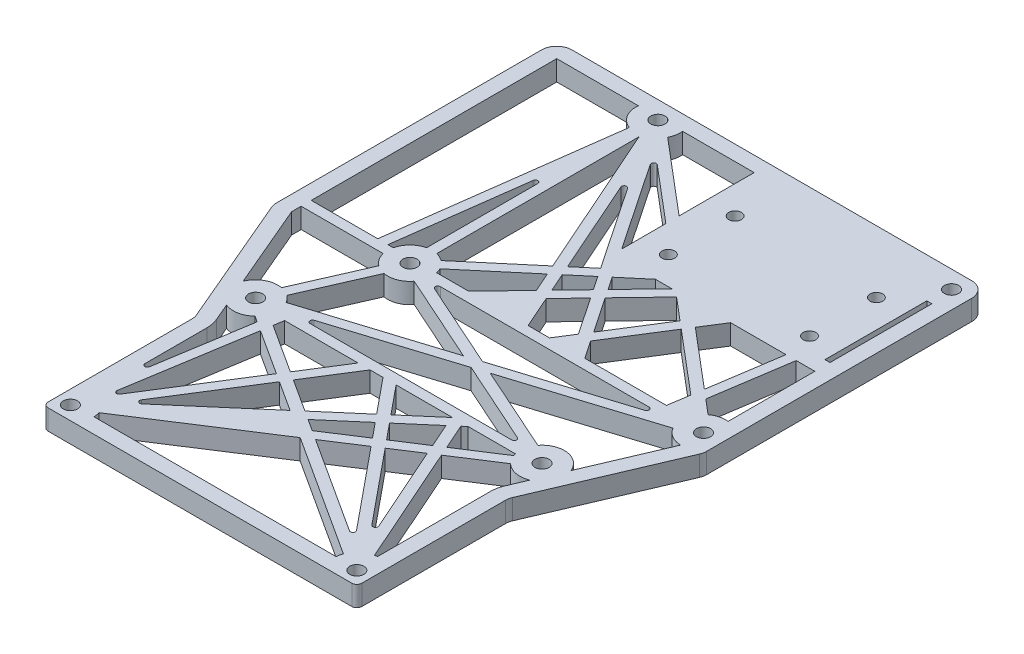
from build123d import *

# Parameters (mm, degrees)
BOSS_EXTRUDE1_DEPTH = 4
SKETCH2_R           = 1.4
CUT_EXTRUDE1_DEPTH  = 96.117033175
SKETCH4_W           = 33
SKETCH4_H           = 28
SKETCH4_R           = 0.75
CUT_EXTRUDE2_DEPTH  = 2
SHELL5_OUTLINE_R    = 4.4
SHELL5_DEPTH        = 1
RIB9_DEPTH          = 1
BOSS_EXTRUDE8_START = 1
SKETCH24_W          = 1
SKETCH24_H          = 3
BOSS_EXTRUDE8_DEPTH = 1
FILLET6_R           = 0.5
FILLET8_R           = 0.5
SKETCH28_OUTSIDE_W  = 115.292
SKETCH28_OUTSIDE_H  = 143.292
CUT_EXTRUDE4_DEPTH  = 4
SKETCH30_R          = 1.25
CUT_EXTRUDE5_DEPTH  = 96.117033175


# Read off the part's stored shape, not the designer's step: Shell5, Rib9
with BuildPart() as part:
    # Sketch1 → Boss-Extrude1 (new body)
    with BuildSketch(Plane(origin=(0, 0, 0), x_dir=(1, 0, 0), z_dir=(0, 1, 0))):
        with BuildLine():
            Line((-42.260071937, -28.563309365), (-31.239928063, -54.436690635))
            ThreePointArc((-31.239928063, -54.436690635), (-31.060593954, -55.012366758), (-31, -55.61227683))
            Line((-31, -55.61227683), (-31, -84))
            ThreePointArc((-31, -84), (-30.707106781, -84.707106781), (-30, -85))
            Line((-30, -85), (30, -85))
            ThreePointArc((30, -85), (30.707106781, -84.707106781), (31, -84))
            Line((31, -84), (31, -55.61227683))
            ThreePointArc((31, -55.61227683), (31.060593954, -55.012366758), (31.239928063, -54.436690635))
            Line((31.239928063, -54.436690635), (42.260071937, -28.563309365))
            ThreePointArc((42.260071937, -28.563309365), (42.439406046, -27.987633242), (42.5, -27.38772317))
            Line((42.5, -27.38772317), (42.5, 25))
            ThreePointArc((42.5, 25), (41.621320344, 27.121320344), (39.5, 28))
            Line((39.5, 28), (-39.5, 28))
            ThreePointArc((-39.5, 28), (-41.621320344, 27.121320344), (-42.5, 25))
            Line((-42.5, 25), (-42.5, -27.38772317))
            ThreePointArc((-42.5, -27.38772317), (-42.439406046, -27.987633242), (-42.260071937, -28.563309365))
        make_face()
    extrude(amount=BOSS_EXTRUDE1_DEPTH)

    # Sketch2 → Cut-Extrude1 (cut, through all)
    with BuildSketch(Plane(origin=(0, 4, 0), x_dir=(1, 0, 0), z_dir=(0, 1, 0))):
        with Locations(Location((39, 24.5, 0), (0, 0, 270))):
            Circle(SKETCH2_R)
        with Locations(Location((-19, 24.5, 0), (0, 0, 270))):
            Circle(SKETCH2_R)
        with Locations(Location((-19, -24.5, 0), (0, 0, 270))):
            Circle(SKETCH2_R)
        with Locations(Location((39, -24.5, 0), (0, 0, 270))):
            Circle(SKETCH2_R)
        with Locations(Location((-28.3, -82.3, 0), (0, 0, 270))):
            Circle(SKETCH2_R)
        with Locations(Location((-28.3, -45.7, 0), (0, 0, 270))):
            Circle(SKETCH2_R)
        with Locations(Location((28.3, -45.7, 0), (0, 0, 270))):
            Circle(SKETCH2_R)
        with Locations(Location((28.3, -82.3, 0), (0, 0, 270))):
            Circle(SKETCH2_R)
    extrude(amount=-CUT_EXTRUDE1_DEPTH, mode=Mode.SUBTRACT)

    # Sketch4 → Cut-Extrude2 (cut)
    with BuildSketch(Plane.XZ):
        with Locations((19, -14)):
            Rectangle(SKETCH4_W, SKETCH4_H)
        with Locations(Location((32.95, -2.5, 0), (0, 0, 270))):
            Circle(SKETCH4_R, mode=Mode.SUBTRACT)
        with Locations(Location((5.05, -2.5, 0), (0, 0, 270))):
            Circle(SKETCH4_R, mode=Mode.SUBTRACT)
        with Locations(Location((5.05, -15.7, 0), (0, 0, 270))):
            Circle(SKETCH4_R, mode=Mode.SUBTRACT)
        with Locations(Location((32.95, -15.7, 0), (0, 0, 270))):
            Circle(SKETCH4_R, mode=Mode.SUBTRACT)
    extrude(amount=-CUT_EXTRUDE2_DEPTH, mode=Mode.SUBTRACT)

    # Shell5 outline → Shell5 (cut)
    with BuildSketch(Plane(origin=(0, 0, 0), x_dir=(1, 0, 0), z_dir=(0, 1, 0))):
        with BuildLine():
            Line((-39.5, -27.38772317), (-32.390632359, -44.079281979))
            ThreePointArc((-32.390632359, -44.079281979), (-24.251894492, -43.975806914), (-29.965740458, -49.772506443))
            Line((-29.965740458, -49.772506443), (-28.479856126, -53.261104439))
            ThreePointArc((-28.479856126, -53.261104439), (-28.121187907, -54.412456686), (-28, -55.61227683))
            Line((-28, -55.61227683), (-28, -77.910239186))
            ThreePointArc((-28, -77.910239186), (-25.188730163, -79.188730163), (-23.910239186, -82))
            Line((-23.910239186, -82), (23.910239186, -82))
            ThreePointArc((23.910239186, -82), (25.188730163, -79.188730163), (28, -77.910239186))
            Line((28, -77.910239186), (28, -55.61227683))
            ThreePointArc((28, -55.61227683), (28.121187907, -54.412456686), (28.479856126, -53.261104439))
            Line((28.479856126, -53.261104439), (29.965740458, -49.772506443))
            ThreePointArc((29.965740458, -49.772506443), (24.251894492, -43.975806914), (32.390632359, -44.079281979))
            Line((32.390632359, -44.079281979), (38.856873846, -28.897671532))
            ThreePointArc((38.856873846, -28.897671532), (34.611785565, -24.178170747), (39.5, -20.128501401))
            Line((39.5, -20.128501401), (39.5, 20.128501401))
            ThreePointArc((39.5, 20.128501401), (39, 20.1), (38.5, 20.128501401))
            Line((38.5, 20.128501401), (38.5, -3))
            Line((38.5, -3), (-0.5, -3))
            Line((-0.5, -3), (-0.5, 25))
            Line((-0.5, 25), (-14.628501401, 25))
            ThreePointArc((-14.628501401, 25), (-19, 20.1), (-23.371498599, 25))
            Line((-23.371498599, 25), (-39.5, 25))
            Line((-39.5, 25), (-39.5, -27.38772317))
        make_face()
        with Locations((-19, -24.5)):
            Circle(SHELL5_OUTLINE_R, mode=Mode.SUBTRACT)
    extrude(amount=SHELL5_DEPTH, mode=Mode.SUBTRACT)

    # Rib9 outline → Rib9 (add)
    # profile 1 of 2: a face of its own
    with BuildSketch(Plane(origin=(0, 0, 0), x_dir=(1, 0, 0), z_dir=(0, 1, 0))):
        with BuildLine():
            Line((24.158874624, -47.186970285), (16.139376012, -52.372723805))
            Line((16.139376012, -52.372723805), (13.918839758, -47.358912558))
            Line((13.918839758, -47.358912558), (14.686051093, -46.7))
            Line((14.686051093, -46.7), (24.015142942, -46.7))
            ThreePointArc((24.015142942, -46.7), (23.997287992, -44.779853608), (24.798922096, -43.034957127))
            Line((24.798922096, -43.034957127), (7.748485262, -35.392900872))
            Line((7.748485262, -35.392900872), (35.213570864, -26.741194858))
            ThreePointArc((35.213570864, -26.741194858), (34.651120693, -25.168766601), (34.715142943, -23.5))
            Line((34.715142943, -23.5), (32.695310169, -23.5))
            Line((32.695310169, -23.5), (33.102743661, -20.826931664))
            Line((33.102743661, -20.826931664), (35.081507638, -22.498646057))
            ThreePointArc((35.081507638, -22.498646057), (35.638903248, -21.660452744), (36.372210936, -20.970874806))
            Line((36.372210936, -20.970874806), (33.456287163, -18.507421963))
            Line((33.456287163, -18.507421963), (35.819954043, -3))
            Line((35.819954043, -3), (33.796855074, -3))
            Line((33.796855074, -3), (31.663983204, -16.993234136))
            Line((31.663983204, -16.993234136), (20.15959754, -7.274011765))
            Line((20.15959754, -7.274011765), (22.852865254, -3))
            Line((22.852865254, -3), (20.488895046, -3))
            Line((20.488895046, -3), (18.61690656, -5.970703868))
            Line((18.61690656, -5.970703868), (15.100563206, -3))
            Line((15.100563206, -3), (11.250729279, -3))
            Line((11.250729279, -3), (5.075272379, -9.441561284))
            Line((5.075272379, -9.441561284), (3.36983318, -6.910444333))
            Line((3.36983318, -6.910444333), (7.99852239, -3))
            Line((7.99852239, -3), (4.899436794, -3))
            Line((4.899436794, -3), (2.24564889, -5.24199323))
            Line((2.24564889, -5.24199323), (0.90818106, -3.256998692))
            Line((0.90818106, -3.256998692), (1.289604065, -3))
            Line((1.289604065, -3), (-0.5, -3))
            Line((-0.5, -3), (-0.5, -1.167055554))
            Line((-0.5, -1.167055554), (-14.153101582, 19.096110008))
            Line((-14.153101582, 19.096110008), (-0.5, 7.561593154))
            Line((-0.5, 7.561593154), (-0.5, 10.179786157))
            Line((-0.5, 10.179786157), (-15.081507637, 22.498646057))
            ThreePointArc((-15.081507637, 22.498646057), (-17.413813627, 20.395854195), (-20.554073865, 20.38358719))
            Line((-20.554073865, 20.38358719), (-26.367711484, -23.5))
            Line((-26.367711484, -23.5), (-39.5, -23.5))
            Line((-39.5, -23.5), (-39.5, -25.5))
            Line((-39.5, -25.5), (-23.284857057, -25.5))
            ThreePointArc((-23.284857057, -25.5), (-23.4, -24.5), (-23.284857057, -23.5))
            Line((-23.284857057, -23.5), (-24.350237234, -23.5))
            Line((-24.350237234, -23.5), (-20, 9.337274602))
            Line((-20, 9.337274602), (-20, -20.215142943))
            ThreePointArc((-20, -20.215142943), (-19, -20.1), (-18, -20.215142943))
            Line((-18, -20.215142943), (-18, 19.772610526))
            Line((-18, 19.772610526), (-4.425393925, -10.877874228))
            Line((-4.425393925, -10.877874228), (-16.372210936, -20.970874806))
            ThreePointArc((-16.372210936, -20.970874806), (-15.638903248, -21.660452743), (-15.081507637, -22.498646057))
            Line((-15.081507637, -22.498646057), (-3.581565647, -12.783177824))
            Line((-3.581565647, -12.783177824), (-1.858385445, -16.673994854))
            Line((-1.858385445, -16.673994854), (-8.402404624, -23.5))
            Line((-8.402404624, -23.5), (-14.715142943, -23.5))
            ThreePointArc((-14.715142943, -23.5), (-14.697287993, -25.420146392), (-15.498922096, -27.165042873))
            Line((-15.498922096, -27.165042873), (2.12935069, -35.066086912))
            Line((2.12935069, -35.066086912), (-24.513570863, -43.458805142))
            ThreePointArc((-24.513570863, -43.458805142), (-23.951120692, -45.031233399), (-24.015142942, -46.7))
            Line((-24.015142942, -46.7), (-23.584833957, -46.7))
            Line((-23.584833957, -46.7), (-23.709900649, -47.477296214))
            Line((-23.709900649, -47.477296214), (-24.158874624, -47.186970285))
            ThreePointArc((-24.158874624, -47.186970285), (-24.605190908, -48.08922284), (-25.244885006, -48.866428964))
            Line((-25.244885006, -48.866428964), (-24.057004266, -49.634563859))
            Line((-24.057004266, -49.634563859), (-28, -74.140494333))
            Line((-28, -74.140494333), (-28, -77.910239186))
            ThreePointArc((-28, -77.910239186), (-25.647181337, -78.789650568), (-24.158874625, -80.813029715))
            Line((-24.158874625, -80.813029715), (0, -65.190859904))
            Line((0, -65.190859904), (24.158874625, -80.813029715))
            ThreePointArc((24.158874625, -80.813029715), (25.442448124, -78.954197066), (27.479202001, -77.977235763))
            Line((27.479202001, -77.977235763), (16.959366166, -54.224202631))
            Line((16.959366166, -54.224202631), (25.244885006, -48.866428964))
            ThreePointArc((25.244885006, -48.866428964), (24.605190908, -48.08922284), (24.158874624, -47.186970285))
        make_face()
        Polygon((-1.841603021, -64), (-16.475927059, -73.463184802), (-3.90431016, -62.666164642), align=None, mode=Mode.SUBTRACT)
        Polygon((-22.222184205, -50.821037609), (-13.28660915, -56.599165648), (-26.534554532, -77.622651039), align=None, mode=Mode.SUBTRACT)
        Polygon((-11.607035166, -57.685250592), (-5.655485793, -61.533778985), (-23.913270157, -77.214312956), align=None, mode=Mode.SUBTRACT)
        Polygon((-21.875080587, -48.663769963), (-21.55911068, -46.7), (-7.048651771, -46.7), (-12.220279169, -54.906980775), align=None, mode=Mode.SUBTRACT)
        Polygon((-10.540705185, -55.993065719), (-4.684681562, -46.7), (-2.125032521, -46.7), (3.54659391, -53.630655554), (-4.073456613, -60.175067445), align=None, mode=Mode.SUBTRACT)
        Polygon((23.485727644, -77.99602405), (1.841603021, -64), (8.505746728, -59.690677391), align=None, mode=Mode.SUBTRACT)
        Polygon((7.231166278, -58.133156249), (0, -62.809140096), (-2.322280979, -61.307453102), (4.813573543, -55.178888594), align=None, mode=Mode.SUBTRACT)
        Polygon((24.391991799, -75.945459753), (10.195758598, -58.59784286), (15.258969679, -55.323752302), align=None, mode=Mode.SUBTRACT)
        Polygon((11.616371053, -46.7), (5.064262408, -52.327219608), (0.459288576, -46.7), align=None, mode=Mode.SUBTRACT)
        Polygon((14.438979526, -53.472273477), (8.921178148, -57.040321718), (6.331242041, -53.875452648), (12.334210769, -48.71985692), align=None, mode=Mode.SUBTRACT)
        Polygon((-21.79716433, -44.7), (4.876801624, -36.297502553), (23.623883193, -44.7), align=None, mode=Mode.SUBTRACT)
        Polygon((32.49716433, -25.5), (5.001034327, -34.161485231), (-14.323883193, -25.5), align=None, mode=Mode.SUBTRACT)
        Polygon((-0.982895403, -18.650788438), (1.164742302, -23.5), (-5.63178341, -23.5), align=None, mode=Mode.SUBTRACT)
        Polygon((-13.495797967, 14.541368816), (0.708829585, -6.540340573), (-2.833608047, -9.533089607), align=None, mode=Mode.SUBTRACT)
        Polygon((9.777050976, -19.998884794), (7.570823885, -23.5), (3.35211163, -23.5), (0.513285951, -17.090135674), (4.802563572, -12.616030339), align=None, mode=Mode.SUBTRACT)
        Polygon((10.99859397, -21.81183021), (12.136064497, -23.5), (9.934794093, -23.5), align=None, mode=Mode.SUBTRACT)
        Polygon((1.833013875, -8.208791676), (3.659017469, -10.918843522), (-0.362204092, -15.11334209), (-1.989779769, -11.438393203), align=None, mode=Mode.SUBTRACT)
        Polygon((17.540237059, -7.679296775), (10.942511379, -18.149387453), (6.218818482, -11.138748101), (13.117474303, -3.942824792), align=None, mode=Mode.SUBTRACT)
        Polygon((31.310439703, -19.312743836), (30.672211199, -23.5), (14.547696186, -23.5), (12.164054373, -19.962332869), (19.08292804, -8.982604673), align=None, mode=Mode.SUBTRACT)
    # profile 2 of 2: a face of its own
    with BuildSketch(Plane(origin=(0, 0, 0), x_dir=(1, 0, 0), z_dir=(0, 1, 0))):
        with BuildLine():
            ThreePointArc((-27.494425912, -41.374372833), (-26.532409776, -41.670654544), (-25.66290525, -42.177822934))
            Line((-25.66290525, -42.177822934), (-19.805574088, -28.825627167))
            ThreePointArc((-19.805574088, -28.825627167), (-20.767590224, -28.529345456), (-21.63709475, -28.022177065))
            Line((-21.63709475, -28.022177065), (-27.494425912, -41.374372833))
        make_face()
    extrude(amount=RIB9_DEPTH)

    # Sketch24 → Boss-Extrude8 (add)
    with BuildSketch(Plane.XZ.offset(-1).offset(BOSS_EXTRUDE8_START)):
        Polygon((-16.475927059, 73.463184802), (-3.90431016, 62.666164642), (-1.841603021, 64), align=None)
        Polygon((18.61690656, 5.970703868), (15.100563206, 3), (20.488895046, 3), align=None)
        Polygon((0.90818106, 3.256998692), (1.289604065, 3), (4.899436794, 3), (2.24564889, 5.24199323), align=None)
        with BuildLine():
            Line((34.715142943, 23.5), (32.695310169, 23.5))
            Line((32.695310169, 23.5), (33.102743661, 20.826931664))
            Line((33.102743661, 20.826931664), (35.081507637, 22.498646057))
            ThreePointArc((35.081507637, 22.498646057), (34.867880344, 22.988184156), (34.715142943, 23.5))
        make_face()
        Polygon((10.99859397, 21.81183021), (12.136064497, 23.5), (9.934794093, 23.5), align=None)
        Polygon((-5.63178341, 23.5), (-0.982895403, 18.650788438), (1.164742302, 23.5), align=None)
        with BuildLine():
            Line((-24.015142943, 46.7), (-23.584833957, 46.7))
            Line((-23.584833957, 46.7), (-23.709900649, 47.477296214))
            Line((-23.709900649, 47.477296214), (-24.158874625, 47.186970285))
            ThreePointArc((-24.158874625, 47.186970285), (-24.079978673, 46.945560115), (-24.015142943, 46.7))
        make_face()
        with Locations((39, 1.5)):
            Rectangle(SKETCH24_W, SKETCH24_H)
    extrude(amount=-BOSS_EXTRUDE8_DEPTH)

    # Fillet6
    fillet6_edges = [part.edges().sort_by_distance(p)[0] for p in [
        (-28, 0.5, 74.140494333),
        (23.485727644, 0.5, 77.99602405),
        (-20, 0.5, -9.337274602),
        (-14.153101582, 0.5, -19.096110008),
        (-23.913270157, 0.5, 77.214312956),
        (-26.534554532, 0.5, 77.622651039),
        (-13.495797967, 0.5, -14.541368816),
        (24.391991799, 0.5, 75.945459753),
    ]]
    fillet(fillet6_edges, radius=FILLET6_R)

    # Fillet8
    fillet8_edges = [part.edges().sort_by_distance(p)[0] for p in [
        (32.49716433, 0.5, 25.5),
        (-14.323883193, 0.5, 25.5),
        (23.623883193, 0.5, 44.7),
        (-21.79716433, 0.5, 44.7),
    ]]
    fillet(fillet8_edges, radius=FILLET8_R)

    # Sketch28 outside → Cut-Extrude4 (cut)
    # profile 1 of 34: a face of its own
    with BuildSketch(Plane(origin=(0, 4, 0), x_dir=(1, 0, 0), z_dir=(0, 1, 0))):
        with Locations((0, -28.5)):
            Rectangle(SKETCH28_OUTSIDE_W, SKETCH28_OUTSIDE_H)
        with BuildLine():
            Line((31, -84), (31, -55.61227683))
            ThreePointArc((31, -55.61227683), (31.060593954, -55.012366758), (31.239928063, -54.436690635))
            Line((31.239928063, -54.436690635), (42.260074154, -28.563304159))
            ThreePointArc((42.260074154, -28.563304159), (42.439406612, -27.98763047), (42.5, -27.38772317))
            Line((42.5, -27.38772317), (42.5, 25))
            ThreePointArc((42.5, 25), (41.621320344, 27.121320344), (39.5, 28))
            Line((39.5, 28), (-39.5, 28))
            ThreePointArc((-39.5, 28), (-41.621320344, 27.121320344), (-42.5, 25))
            Line((-42.5, 25), (-42.5, -27.38772317))
            ThreePointArc((-42.5, -27.38772317), (-42.439406046, -27.987633242), (-42.260071937, -28.563309365))
            Line((-42.260071937, -28.563309365), (-31.239928063, -54.436690635))
            ThreePointArc((-31.239928063, -54.436690635), (-31.060593954, -55.012366758), (-31, -55.61227683))
            Line((-31, -55.61227683), (-31, -84))
            ThreePointArc((-31, -84), (-30.707106781, -84.707106781), (-30, -85))
            Line((-30, -85), (30, -85))
            ThreePointArc((30, -85), (30.707106781, -84.707106781), (31, -84))
        make_face(mode=Mode.SUBTRACT)
    # profile 2 of 34: a face of its own
    with BuildSketch(Plane(origin=(0, 4, 0), x_dir=(1, 0, 0), z_dir=(0, 1, 0))):
        with BuildLine():
            Line((0, -65.190859904), (24.158874625, -80.813029715))
            ThreePointArc((24.158874625, -80.813029715), (23.99346666, -81.397907657), (23.910239186, -82))
            Line((23.910239186, -82), (-23.910239186, -82))
            ThreePointArc((-23.910239186, -82), (-23.99346666, -81.397907657), (-24.158874625, -80.813029715))
            Line((-24.158874625, -80.813029715), (0, -65.190859904))
        make_face()
    # profile 3 of 34: a face of its own
    with BuildSketch(Plane(origin=(0, 4, 0), x_dir=(1, 0, 0), z_dir=(0, 1, 0))):
        with BuildLine():
            Line((27.479202001, -77.977235763), (16.959366166, -54.224202631))
            Line((16.959366166, -54.224202631), (25.244885007, -48.866428963))
            ThreePointArc((25.244885007, -48.866428963), (27.470642116, -50.021130118), (29.965740458, -49.772506443))
            Line((29.965740458, -49.772506443), (28.479856126, -53.261104439))
            ThreePointArc((28.479856126, -53.261104439), (28.121187907, -54.412456686), (28, -55.61227683))
            Line((28, -55.61227683), (28, -77.910239186))
            ThreePointArc((28, -77.910239186), (27.7386007, -77.935961638), (27.479202001, -77.977235763))
        make_face()
    # profile 4 of 34: a face of its own
    with BuildSketch(Plane(origin=(0, 4, 0), x_dir=(1, 0, 0), z_dir=(0, 1, 0))):
        with BuildLine():
            Line((15.258969679, -55.323752302), (22.895157865, -72.565716325))
            ThreePointArc((22.895157865, -72.565716325), (22.699915932, -73.194092905), (22.051038879, -73.084844978))
            Line((22.051038879, -73.084844978), (10.195758598, -58.59784286))
            Line((10.195758598, -58.59784286), (15.258969679, -55.323752302))
        make_face()
    # profile 5 of 34: a face of its own
    with BuildSketch(Plane(origin=(0, 4, 0), x_dir=(1, 0, 0), z_dir=(0, 1, 0))):
        with BuildLine():
            Line((8.505746728, -59.690677391), (21.465540287, -75.527380725))
            ThreePointArc((21.465540287, -75.527380725), (21.451347945, -76.177281641), (20.807088871, -76.263900744))
            Line((20.807088871, -76.263900744), (1.841603021, -64))
            Line((1.841603021, -64), (8.505746728, -59.690677391))
        make_face()
    # profile 6 of 34: a face of its own
    with BuildSketch(Plane(origin=(0, 4, 0), x_dir=(1, 0, 0), z_dir=(0, 1, 0))):
        Polygon((-2.322280979, -61.307453102), (4.813573543, -55.178888594), (7.231166278, -58.133156249), (0, -62.809140096), align=None)
    # profile 7 of 34: a face of its own
    with BuildSketch(Plane(origin=(0, 4, 0), x_dir=(1, 0, 0), z_dir=(0, 1, 0))):
        with BuildLine():
            Line((16.139376012, -52.372723805), (13.918839758, -47.358912558))
            Line((13.918839758, -47.358912558), (14.686051093, -46.7))
            Line((14.686051093, -46.7), (24.015142943, -46.7))
            ThreePointArc((24.015142943, -46.7), (24.079978673, -46.945560115), (24.158874625, -47.186970285))
            Line((24.158874625, -47.186970285), (16.139376012, -52.372723805))
        make_face()
    # profile 8 of 34: a face of its own
    with BuildSketch(Plane(origin=(0, 4, 0), x_dir=(1, 0, 0), z_dir=(0, 1, 0))):
        Polygon((6.331242041, -53.875452648), (12.334210769, -48.71985692), (14.438979526, -53.472273477), (8.921178148, -57.040321718), align=None)
    # profile 9 of 34: a face of its own
    with BuildSketch(Plane(origin=(0, 4, 0), x_dir=(1, 0, 0), z_dir=(0, 1, 0))):
        Polygon((11.616371053, -46.7), (5.064262408, -52.327219608), (0.459288576, -46.7), align=None)
    # profile 10 of 34: a face of its own
    with BuildSketch(Plane(origin=(0, 4, 0), x_dir=(1, 0, 0), z_dir=(0, 1, 0))):
        with BuildLine():
            Line((-5.655485793, -61.533778985), (-21.394138385, -75.050779279))
            ThreePointArc((-21.394138385, -75.050779279), (-22.046482524, -75.050081736), (-22.142922411, -74.40490524))
            Line((-22.142922411, -74.40490524), (-11.607035166, -57.685250592))
            Line((-11.607035166, -57.685250592), (-5.655485793, -61.533778985))
        make_face()
    # profile 11 of 34: a face of its own
    with BuildSketch(Plane(origin=(0, 4, 0), x_dir=(1, 0, 0), z_dir=(0, 1, 0))):
        Polygon((-4.073456613, -60.175067445), (-10.540705185, -55.993065719), (-4.684681562, -46.7), (-2.125032521, -46.7), (3.54659391, -53.630655554), align=None)
    # profile 12 of 34: a face of its own
    with BuildSketch(Plane(origin=(0, 4, 0), x_dir=(1, 0, 0), z_dir=(0, 1, 0))):
        Polygon((-21.55911068, -46.7), (-7.048651771, -46.7), (-12.220279169, -54.906980775), (-21.875080587, -48.663769963), align=None)
    # profile 13 of 34: a face of its own
    with BuildSketch(Plane(origin=(0, 4, 0), x_dir=(1, 0, 0), z_dir=(0, 1, 0))):
        with BuildLine():
            Line((-13.28660915, -56.599165648), (-25.228814623, -75.550540752))
            ThreePointArc((-25.228814623, -75.550540752), (-25.828396153, -75.751763934), (-26.14548264, -75.204548309))
            Line((-26.14548264, -75.204548309), (-22.222184205, -50.821037609))
            Line((-22.222184205, -50.821037609), (-13.28660915, -56.599165648))
        make_face()
    # profile 14 of 34: a face of its own
    with BuildSketch(Plane(origin=(0, 4, 0), x_dir=(1, 0, 0), z_dir=(0, 1, 0))):
        with BuildLine():
            Line((-24.057004266, -49.634563859), (-27.006349159, -67.964900932))
            ThreePointArc((-27.006349159, -67.964900932), (-27.539840804, -68.383882865), (-28, -67.885472682))
            Line((-28, -67.885472682), (-28, -55.61227683))
            ThreePointArc((-28, -55.61227683), (-28.121187907, -54.412456686), (-28.479856126, -53.261104439))
            Line((-28.479856126, -53.261104439), (-29.965740458, -49.772506443))
            ThreePointArc((-29.965740458, -49.772506443), (-27.470642116, -50.021130118), (-25.244885007, -48.866428963))
            Line((-25.244885007, -48.866428963), (-24.057004266, -49.634563859))
        make_face()
    # profile 15 of 34: a face of its own
    with BuildSketch(Plane(origin=(0, 4, 0), x_dir=(1, 0, 0), z_dir=(0, 1, 0))):
        with BuildLine():
            Line((21.285824789, -44.7), (-18.545746494, -44.7))
            ThreePointArc((-18.545746494, -44.7), (-19.039937325, -44.275996205), (-18.695973004, -43.723101692))
            Line((-18.695973004, -43.723101692), (4.876801624, -36.297502553))
            Line((4.876801624, -36.297502553), (21.490325044, -43.743732923))
            ThreePointArc((21.490325044, -43.743732923), (21.774769336, -44.30456209), (21.285824789, -44.7))
        make_face()
    # profile 16 of 34: a face of its own
    with BuildSketch(Plane(origin=(0, 4, 0), x_dir=(1, 0, 0), z_dir=(0, 1, 0))):
        with BuildLine():
            Line((24.798922096, -43.034957127), (7.748485262, -35.392900872))
            Line((7.748485262, -35.392900872), (35.213570863, -26.741194858))
            ThreePointArc((35.213570863, -26.741194858), (36.758806321, -28.286429834), (38.856873846, -28.897671532))
            Line((38.856873846, -28.897671532), (32.390632359, -44.079281979))
            ThreePointArc((32.390632359, -44.079281979), (28.899622559, -41.341049119), (24.798922096, -43.034957127))
        make_face()
    # profile 17 of 34: a face of its own
    with BuildSketch(Plane(origin=(0, 4, 0), x_dir=(1, 0, 0), z_dir=(0, 1, 0))):
        with BuildLine():
            Line((5.001034327, -34.161485231), (-12.190325044, -26.456267077))
            ThreePointArc((-12.190325044, -26.456267077), (-12.474769336, -25.89543791), (-11.985824789, -25.5))
            Line((-11.985824789, -25.5), (29.245746494, -25.5))
            ThreePointArc((29.245746494, -25.5), (29.739937325, -25.924003795), (29.395973004, -26.476898308))
            Line((29.395973004, -26.476898308), (5.001034327, -34.161485231))
        make_face()
    # profile 18 of 34: a face of its own
    with BuildSketch(Plane(origin=(0, 4, 0), x_dir=(1, 0, 0), z_dir=(0, 1, 0))):
        with BuildLine():
            Line((-15.498922096, -27.165042873), (2.12935069, -35.066086912))
            Line((2.12935069, -35.066086912), (-24.513570863, -43.458805142))
            ThreePointArc((-24.513570863, -43.458805142), (-25.024997155, -42.761572467), (-25.66290525, -42.177822935))
            Line((-25.66290525, -42.177822935), (-19.805574088, -28.825627167))
            ThreePointArc((-19.805574088, -28.825627167), (-17.417021714, -28.605384238), (-15.498922096, -27.165042873))
        make_face()
    # profile 19 of 34: a face of its own
    with BuildSketch(Plane(origin=(0, 4, 0), x_dir=(1, 0, 0), z_dir=(0, 1, 0))):
        with BuildLine():
            Line((-39.5, -25.5), (-23.284857057, -25.5))
            ThreePointArc((-23.284857057, -25.5), (-22.683571432, -26.906512312), (-21.63709475, -28.022177065))
            Line((-21.63709475, -28.022177065), (-27.494425912, -41.374372833))
            ThreePointArc((-27.494425912, -41.374372833), (-30.42768309, -41.848641192), (-32.390632359, -44.079281979))
            Line((-32.390632359, -44.079281979), (-39.5, -27.38772317))
            Line((-39.5, -27.38772317), (-39.5, -25.5))
        make_face()
    # profile 20 of 34: a face of its own
    with BuildSketch(Plane(origin=(0, 4, 0), x_dir=(1, 0, 0), z_dir=(0, 1, 0))):
        with BuildLine():
            Line((-1.858385445, -16.673994854), (-8.402404624, -23.5))
            Line((-8.402404624, -23.5), (-14.715142943, -23.5))
            ThreePointArc((-14.715142943, -23.5), (-14.867880344, -22.988184156), (-15.081507637, -22.498646057))
            Line((-15.081507637, -22.498646057), (-3.581565647, -12.783177824))
            Line((-3.581565647, -12.783177824), (-1.858385445, -16.673994854))
        make_face()
    # profile 21 of 34: a face of its own
    with BuildSketch(Plane(origin=(0, 4, 0), x_dir=(1, 0, 0), z_dir=(0, 1, 0))):
        Polygon((3.659017469, -10.918843522), (-0.362204092, -15.11334209), (-1.989779769, -11.438393203), (1.833013875, -8.208791676), align=None)
    # profile 22 of 34: a face of its own
    with BuildSketch(Plane(origin=(0, 4, 0), x_dir=(1, 0, 0), z_dir=(0, 1, 0))):
        Polygon((7.99852239, -3), (11.250729279, -3), (5.075272379, -9.441561284), (3.36983318, -6.910444333), align=None)
    # profile 23 of 34: a face of its own
    with BuildSketch(Plane(origin=(0, 4, 0), x_dir=(1, 0, 0), z_dir=(0, 1, 0))):
        Polygon((3.35211163, -23.5), (0.513285951, -17.090135674), (4.802563572, -12.616030339), (9.777050976, -19.998884794), (7.570823885, -23.5), align=None)
    # profile 24 of 34: a face of its own
    with BuildSketch(Plane(origin=(0, 4, 0), x_dir=(1, 0, 0), z_dir=(0, 1, 0))):
        Polygon((30.672211199, -23.5), (14.547696186, -23.5), (12.164054373, -19.962332869), (19.08292804, -8.982604673), (31.310439703, -19.312743836), align=None)
    # profile 25 of 34: a face of its own
    with BuildSketch(Plane(origin=(0, 4, 0), x_dir=(1, 0, 0), z_dir=(0, 1, 0))):
        Polygon((6.218818482, -11.138748101), (13.117474303, -3.942824792), (17.540237059, -7.679296775), (10.942511379, -18.149387453), align=None)
    # profile 26 of 34: a face of its own
    with BuildSketch(Plane(origin=(0, 4, 0), x_dir=(1, 0, 0), z_dir=(0, 1, 0))):
        Polygon((22.852865254, -3), (33.796855074, -3), (31.663983204, -16.993234136), (20.15959754, -7.274011765), align=None)
    # profile 27 of 34: a face of its own
    with BuildSketch(Plane(origin=(0, 4, 0), x_dir=(1, 0, 0), z_dir=(0, 1, 0))):
        with BuildLine():
            Line((35.819954043, -3), (39.5, -3))
            Line((39.5, -3), (39.5, -20.128501401))
            ThreePointArc((39.5, -20.128501401), (37.855766714, -20.25138491), (36.372210936, -20.970874806))
            Line((36.372210936, -20.970874806), (33.456287163, -18.507421963))
            Line((33.456287163, -18.507421963), (35.819954043, -3))
        make_face()
    # profile 28 of 34: a face of its own
    with BuildSketch(Plane(origin=(0, 4, 0), x_dir=(1, 0, 0), z_dir=(0, 1, 0))):
        with BuildLine():
            Line((39.5, 20.128501401), (39.5, 0))
            Line((39.5, 0), (38.5, 0))
            Line((38.5, 0), (38.5, 20.128501401))
            ThreePointArc((38.5, 20.128501401), (39, 20.1), (39.5, 20.128501401))
        make_face()
    # profile 29 of 34: a face of its own
    with BuildSketch(Plane(origin=(0, 4, 0), x_dir=(1, 0, 0), z_dir=(0, 1, 0))):
        with BuildLine():
            Line((-0.5, 25), (-0.5, 10.179786157))
            Line((-0.5, 10.179786157), (-15.081507637, 22.498646057))
            ThreePointArc((-15.081507637, 22.498646057), (-14.670429534, 23.715895684), (-14.628501401, 25))
            Line((-14.628501401, 25), (-0.5, 25))
        make_face()
    # profile 30 of 34: a face of its own
    with BuildSketch(Plane(origin=(0, 4, 0), x_dir=(1, 0, 0), z_dir=(0, 1, 0))):
        with BuildLine():
            Line((-0.5, -1.167055554), (-12.14430939, 16.114773603))
            ThreePointArc((-12.14430939, 16.114773603), (-12.063502449, 16.766380174), (-11.406976549, 16.776107824))
            Line((-11.406976549, 16.776107824), (-0.5, 7.561593154))
            Line((-0.5, 7.561593154), (-0.5, -1.167055554))
        make_face()
    # profile 31 of 34: a face of its own
    with BuildSketch(Plane(origin=(0, 4, 0), x_dir=(1, 0, 0), z_dir=(0, 1, 0))):
        with BuildLine():
            Line((-2.833608047, -9.533089607), (-11.200867117, 9.35957992))
            ThreePointArc((-11.200867117, 9.35957992), (-10.985565184, 9.999660077), (-10.329039934, 9.841444632))
            Line((-10.329039934, 9.841444632), (0.708829585, -6.540340573))
            Line((0.708829585, -6.540340573), (-2.833608047, -9.533089607))
        make_face()
    # profile 32 of 34: a face of its own
    with BuildSketch(Plane(origin=(0, 4, 0), x_dir=(1, 0, 0), z_dir=(0, 1, 0))):
        with BuildLine():
            Line((-18, 19.772610526), (-4.425393925, -10.877874228))
            Line((-4.425393925, -10.877874228), (-16.372210936, -20.970874806))
            ThreePointArc((-16.372210936, -20.970874806), (-17.147165405, -20.509134935), (-18, -20.215142943))
            Line((-18, -20.215142943), (-18, 19.772610526))
        make_face()
    # profile 33 of 34: a face of its own
    with BuildSketch(Plane(origin=(0, 4, 0), x_dir=(1, 0, 0), z_dir=(0, 1, 0))):
        with BuildLine():
            Line((-24.350237234, -23.5), (-20.995669275, 1.821577491))
            ThreePointArc((-20.995669275, 1.821577491), (-20.467095879, 2.254828047), (-20, 1.755911903))
            Line((-20, 1.755911903), (-20, -20.215142943))
            ThreePointArc((-20, -20.215142943), (-22.111269837, -21.388730163), (-23.284857057, -23.5))
            Line((-23.284857057, -23.5), (-24.350237234, -23.5))
        make_face()
    # profile 34 of 34: a face of its own
    with BuildSketch(Plane(origin=(0, 4, 0), x_dir=(1, 0, 0), z_dir=(0, 1, 0))):
        with BuildLine():
            Line((-20.554073865, 20.38358719), (-26.367711484, -23.5))
            Line((-26.367711484, -23.5), (-39.5, -23.5))
            Line((-39.5, -23.5), (-39.5, 25))
            Line((-39.5, 25), (-23.371498599, 25))
            ThreePointArc((-23.371498599, 25), (-22.755784747, 22.207821792), (-20.554073865, 20.38358719))
        make_face()
    extrude(amount=-CUT_EXTRUDE4_DEPTH, mode=Mode.SUBTRACT)

    # Sketch30 → Cut-Extrude5 (cut, through all)
    with BuildSketch(Plane.XZ):
        with Locations(Location((32.95, -15.7, 0), (0, 0, 270))):
            Circle(SKETCH30_R)
        with Locations(Location((5.05, -15.7, 0), (0, 0, 270))):
            Circle(SKETCH30_R)
        with Locations(Location((5.05, -2.5, 0), (0, 0, 270))):
            Circle(SKETCH30_R)
        with Locations(Location((32.95, -2.5, 0), (0, 0, 270))):
            Circle(SKETCH30_R)
    extrude(amount=-CUT_EXTRUDE5_DEPTH, mode=Mode.SUBTRACT)


solid = part.part
